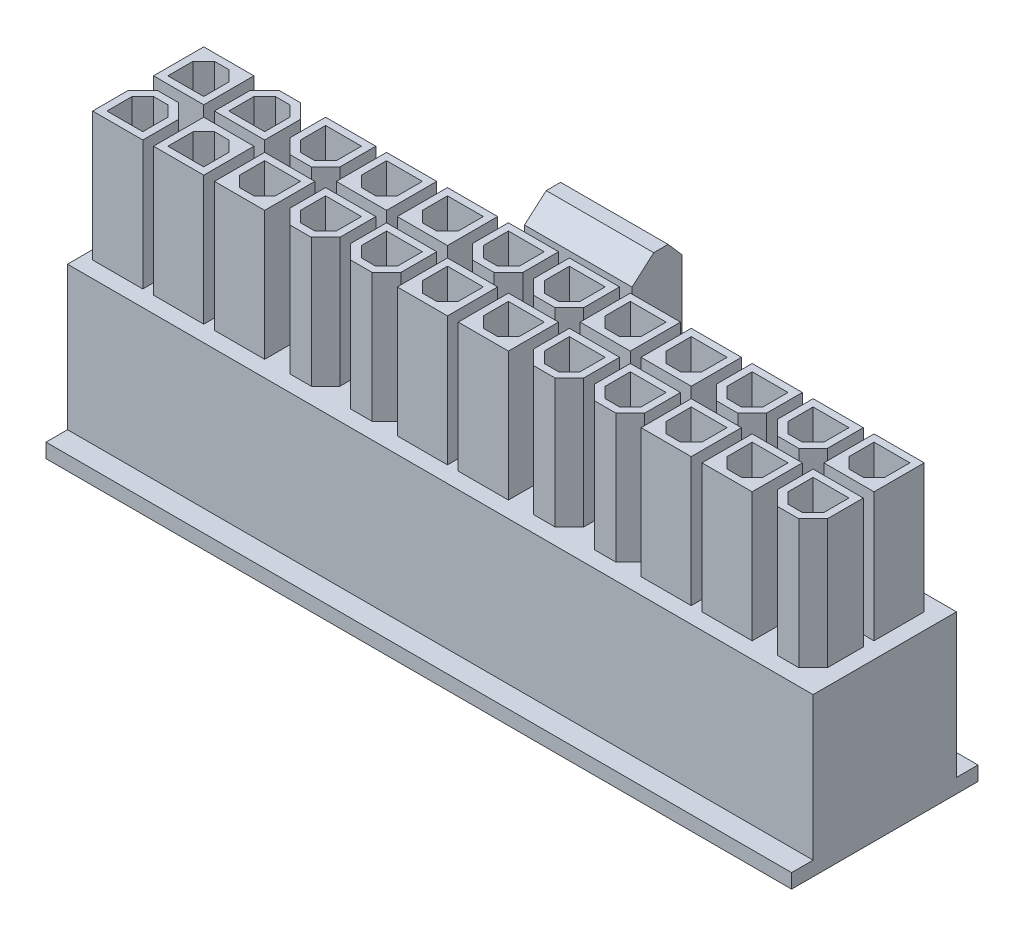
from build123d import *

# Parameters (mm, degrees)
SKIZZE1_W                       = 10
SKIZZE1_H                       = 11
AUFSATZ_LINEAR_AUSTRAGEN1_DEPTH = 26
SKIZZE2_W                       = 1.5
SKIZZE2_H                       = 1
AUFSATZ_LINEAR_AUSTRAGEN2_DEPTH = 26
AUFSATZ_LINEAR_AUSTRAGEN3_DEPTH = 5
SKIZZE4_W                       = 7
SKIZZE4_H                       = 1.5
SCHNITT_LINEAR_AUSTRAGEN1_DEPTH = 30.483045976
AUFSATZ_LINEAR_AUSTRAGEN4_DEPTH = 3.75
SKIZZE6_W                       = 3.75
SKIZZE6_H                       = 3.75
SCHNITT_LINEAR_AUSTRAGEN2_DEPTH = 10
LINEARES_MUSTER1_COUNT          = 12
LINEARES_MUSTER1_PITCH          = 4.25
LINEARES_MUSTER1_COUNT_DIR2     = 2
LINEARES_MUSTER1_PITCH_DIR2     = 4.25
SKIZZE7_W                       = 3.5
SKIZZE7_H                       = 3.5
AUFSATZ_LINEAR_AUSTRAGEN5_DEPTH = 9
LINEARES_START                  = 0.375
LINEARES_MUSTER2_OUTLINE_W      = 3.5
LINEARES_MUSTER2_OUTLINE_H      = 9
LINEARES_MUSTER2_DEPTH          = 3.5
LINEARES_START_2                = -3.875
LINEARES_MUSTER2_2_OUTLINE_W    = 3.5
LINEARES_MUSTER2_2_OUTLINE_H    = 9
LINEARES_MUSTER2_2_DEPTH        = 3.5
AUFSATZ_LINEAR_AUSTRAGEN6_DEPTH = 9
LINEARES_START_3                = 11
LINEARES_MUSTER3_DEPTH          = 9
AUFSATZ_LINEAR_AUSTRAGEN7_DEPTH = 9
LINEARES_START_4                = 10
LINEARES_MUSTER4_DEPTH          = 10
SCHNITT_LINEAR_AUSTRAGEN3_DEPTH = 34.88583775
LINEARES_MUSTER5_COUNT          = 10
LINEARES_MUSTER5_PITCH          = 4.25
LINEARES_MUSTER5_COUNT_DIR2     = 2
LINEARES_MUSTER5_PITCH_DIR2     = 4.25
SCHNITT_LINEAR_AUSTRAGEN4_DEPTH = 34.88583775
LINEARES_MUSTER6_COUNT          = 2
LINEARES_MUSTER6_PITCH          = 4.25
LINEARES_MUSTER6_COUNT_DIR2     = 2
LINEARES_MUSTER6_PITCH_DIR2     = 4.25


with BuildPart() as part:
    # Skizze1 → Aufsatz-Linear austragen1 (new, symmetric)
    with BuildSketch(Plane(origin=(0, 0, 0), x_dir=(0, 0, -1), z_dir=(1, 0, 0))):
        with Locations((0, 5.5)):
            Rectangle(SKIZZE1_W, SKIZZE1_H)
    extrude(amount=AUFSATZ_LINEAR_AUSTRAGEN1_DEPTH, both=True)

    # Skizze2 → Aufsatz-Linear austragen2 (add, symmetric)
    with BuildSketch(Plane(origin=(0, 0, 0), x_dir=(0, 0, -1), z_dir=(1, 0, 0))):
        with Locations((-5.75, 0.5)):
            Rectangle(SKIZZE2_W, SKIZZE2_H)
        with Locations((5.75, 0.5)):
            Rectangle(SKIZZE2_W, SKIZZE2_H)
    extrude(amount=AUFSATZ_LINEAR_AUSTRAGEN2_DEPTH, both=True)

    # Skizze3 → Aufsatz-Linear austragen3 (add, symmetric)
    with BuildSketch(Plane(origin=(0, 0, 0), x_dir=(0, 0, -1), z_dir=(1, 0, 0))):
        with BuildLine():
            Line((5, 11), (5.571713615, 11))
            ThreePointArc((5.571713615, 11), (5.836038655, 10.149642784), (6.535856807, 9.598979842))
            ThreePointArc((6.535856807, 9.598979842), (7.23567496, 9.048316901), (7.5, 8.197959685))
            Line((7.5, 8.197959685), (7.5, 5.197959685))
            Line((7.5, 5.197959685), (8.5, 4))
            Line((8.5, 4), (8.5, 2))
            Line((8.5, 2), (6.5, 2))
            Line((6.5, 2), (6.5, 8))
            Line((6.5, 8), (5, 8))
            Line((5, 8), (5, 11))
        make_face()
    extrude(amount=AUFSATZ_LINEAR_AUSTRAGEN3_DEPTH, both=True)

    # Skizze4 → Schnitt-Linear austragen1 (cut, through all)
    with BuildSketch(Plane.XZ):
        with Locations((0, -5.75)):
            Rectangle(SKIZZE4_W, SKIZZE4_H)
    extrude(amount=-SCHNITT_LINEAR_AUSTRAGEN1_DEPTH, mode=Mode.SUBTRACT)

    # Skizze5 → Aufsatz-Linear austragen4 (add, symmetric)
    with BuildSketch(Plane(origin=(0, 0, 0), x_dir=(0, 0, -1), z_dir=(1, 0, 0))):
        Polygon((8.123516438, 4.451012129), (8.123516438, 19.870653012), (7.136310593, 21), (6.136310593, 21), (4.623516438, 19.677608169), (4.623516438, 17.677608169), (6.123516438, 17.677608169), (6.5, 8), (6.5, 2), align=None)
    extrude(amount=AUFSATZ_LINEAR_AUSTRAGEN4_DEPTH, both=True)

    # Skizze6 → Schnitt-Linear austragen2 (cut)
    with BuildSketch(Plane.XZ):
        with Locations((-23.625, -2.125)):
            Rectangle(SKIZZE6_W, SKIZZE6_H)
    schnitt_linear_austragen2 = extrude(amount=-SCHNITT_LINEAR_AUSTRAGEN2_DEPTH, mode=Mode.SUBTRACT)

    # Lineares Muster1: Schnitt-Linear austragen2 12 × 2
    with Locations(*[(i * LINEARES_MUSTER1_PITCH, 0, j * LINEARES_MUSTER1_PITCH_DIR2) for i in range(LINEARES_MUSTER1_COUNT) for j in range(LINEARES_MUSTER1_COUNT_DIR2) if (i, j) != (0, 0)]):
        add(schnitt_linear_austragen2, mode=Mode.SUBTRACT)

    # Skizze7 → Aufsatz-Linear austragen5 (add)
    with BuildSketch(Plane(origin=(0, 11, 0), x_dir=(1, 0, 0), z_dir=(0, 1, 0))):
        with Locations((23.125, 2.125)):
            Rectangle(SKIZZE7_W, SKIZZE7_H)
    extrude(amount=AUFSATZ_LINEAR_AUSTRAGEN5_DEPTH)

    # Lineares Muster2: read off the stored shape, not the designer's step
    # Lineares Muster2 outline → Lineares Muster2 (add)
    with BuildSketch(Plane.XY.offset(LINEARES_START)):
        with Locations((18.875, 15.5)):
            Rectangle(LINEARES_MUSTER2_OUTLINE_W, LINEARES_MUSTER2_OUTLINE_H)
        with Locations((14.625, 15.5)):
            Rectangle(LINEARES_MUSTER2_OUTLINE_W, LINEARES_MUSTER2_OUTLINE_H)
        with Locations((-19.375, 15.5)):
            Rectangle(LINEARES_MUSTER2_OUTLINE_W, LINEARES_MUSTER2_OUTLINE_H)
        with Locations((-15.125, 15.5)):
            Rectangle(LINEARES_MUSTER2_OUTLINE_W, LINEARES_MUSTER2_OUTLINE_H)
        with Locations((-2.375, 15.5)):
            Rectangle(LINEARES_MUSTER2_OUTLINE_W, LINEARES_MUSTER2_OUTLINE_H)
        with Locations((1.875, 15.5)):
            Rectangle(LINEARES_MUSTER2_OUTLINE_W, LINEARES_MUSTER2_OUTLINE_H)
    extrude(amount=LINEARES_MUSTER2_DEPTH)

    # Lineares Muster2 2 outline → Lineares Muster2 2 (add)
    with BuildSketch(Plane.XY.offset(LINEARES_START_2)):
        with Locations((10.375, 15.5)):
            Rectangle(LINEARES_MUSTER2_2_OUTLINE_W, LINEARES_MUSTER2_2_OUTLINE_H)
        with Locations((-23.625, 15.5)):
            Rectangle(LINEARES_MUSTER2_2_OUTLINE_W, LINEARES_MUSTER2_2_OUTLINE_H)
        with Locations((-10.875, 15.5)):
            Rectangle(LINEARES_MUSTER2_2_OUTLINE_W, LINEARES_MUSTER2_2_OUTLINE_H)
        with Locations((-6.625, 15.5)):
            Rectangle(LINEARES_MUSTER2_2_OUTLINE_W, LINEARES_MUSTER2_2_OUTLINE_H)
        with Locations((6.125, 15.5)):
            Rectangle(LINEARES_MUSTER2_2_OUTLINE_W, LINEARES_MUSTER2_2_OUTLINE_H)
    extrude(amount=LINEARES_MUSTER2_2_DEPTH)

    # Skizze9 → Aufsatz-Linear austragen6 (add)
    with BuildSketch(Plane(origin=(0, 11, 0), x_dir=(1, 0, 0), z_dir=(0, 1, 0))):
        Polygon((24.875, -2.875), (23.875, -3.875), (22.375, -3.875), (21.375, -2.875), (21.375, -0.375), (24.875, -0.375), align=None)
    extrude(amount=AUFSATZ_LINEAR_AUSTRAGEN6_DEPTH)

    # Lineares Muster3: read off the stored shape, not the designer's step
    # Lineares Muster3 outline → Lineares Muster3 (add)
    with BuildSketch(Plane(origin=(0, 0, 0), x_dir=(1, 0, 0), z_dir=(0, 1, 0)).offset(LINEARES_START_3)):
        Polygon((18.125, 0.375), (19.625, 0.375), (20.625, 1.375), (20.625, 3.875), (17.125, 3.875), (17.125, 1.375), align=None)
        Polygon((13.875, 0.375), (15.375, 0.375), (16.375, 1.375), (16.375, 3.875), (12.875, 3.875), (12.875, 1.375), align=None)
        Polygon((1.125, 0.375), (2.625, 0.375), (3.625, 1.375), (3.625, 3.875), (0.125, 3.875), (0.125, 1.375), align=None)
        Polygon((-3.125, 0.375), (-1.625, 0.375), (-0.625, 1.375), (-0.625, 3.875), (-4.125, 3.875), (-4.125, 1.375), align=None)
        Polygon((-15.875, 0.375), (-14.375, 0.375), (-13.375, 1.375), (-13.375, 3.875), (-16.875, 3.875), (-16.875, 1.375), align=None)
        Polygon((8.625, -0.375), (8.625, -2.875), (9.625, -3.875), (11.125, -3.875), (12.125, -2.875), (12.125, -0.375), align=None)
        Polygon((7.875, -2.875), (7.875, -0.375), (4.375, -0.375), (4.375, -2.875), (5.375, -3.875), (6.875, -3.875), align=None)
        Polygon((-4.875, -2.875), (-4.875, -0.375), (-8.375, -0.375), (-8.375, -2.875), (-7.375, -3.875), (-5.875, -3.875), align=None)
        Polygon((-9.125, -2.875), (-9.125, -0.375), (-12.625, -0.375), (-12.625, -2.875), (-11.625, -3.875), (-10.125, -3.875), align=None)
    extrude(amount=LINEARES_MUSTER3_DEPTH)

    # Skizze10 → Aufsatz-Linear austragen7 (add)
    with BuildSketch(Plane(origin=(0, 11, 0), x_dir=(1, 0, 0), z_dir=(0, 1, 0))):
        Polygon((-18.625, 3.875), (-17.625, 2.875), (-17.625, 0.375), (-21.125, 0.375), (-21.125, 2.875), (-20.125, 3.875), align=None)
    extrude(amount=AUFSATZ_LINEAR_AUSTRAGEN7_DEPTH)

    # Lineares Muster4: read off the stored shape, not the designer's step
    # Lineares Muster4 outline → Lineares Muster4 (add)
    with BuildSketch(Plane(origin=(0, 0, 0), x_dir=(1, 0, 0), z_dir=(0, 1, 0)).offset(LINEARES_START_4)):
        Polygon((-21.875, -3.875), (-21.875, -1.375), (-22.875, -0.375), (-24.375, -0.375), (-25.375, -1.375), (-25.375, -3.875), align=None)
    extrude(amount=LINEARES_MUSTER4_DEPTH)

    # Skizze11 → Schnitt-Linear austragen3 (cut, through all)
    with BuildSketch(Plane(origin=(0, 20, 0), x_dir=(1, 0, 0), z_dir=(0, 1, 0))):
        Polygon((23.625, -3.375), (24.375, -2.625), (24.375, -0.875), (21.875, -0.875), (21.875, -2.625), (22.625, -3.375), align=None)
    schnitt_linear_austragen3 = extrude(amount=-SCHNITT_LINEAR_AUSTRAGEN3_DEPTH, mode=Mode.SUBTRACT)

    # Lineares Muster5: Schnitt-Linear austragen3 10 × 2
    with Locations(*[(-i * LINEARES_MUSTER5_PITCH, 0, -j * LINEARES_MUSTER5_PITCH_DIR2) for i in range(LINEARES_MUSTER5_COUNT) for j in range(LINEARES_MUSTER5_COUNT_DIR2) if (i, j) != (0, 0)]):
        add(schnitt_linear_austragen3, mode=Mode.SUBTRACT)

    # Skizze12 → Schnitt-Linear austragen4 (cut, through all)
    with BuildSketch(Plane(origin=(0, 20, 0), x_dir=(1, 0, 0), z_dir=(0, 1, 0))):
        Polygon((-20.625, 2.625), (-19.875, 3.375), (-18.875, 3.375), (-18.125, 2.625), (-18.125, 0.875), (-20.625, 0.875), align=None)
    schnitt_linear_austragen4 = extrude(amount=-SCHNITT_LINEAR_AUSTRAGEN4_DEPTH, mode=Mode.SUBTRACT)

    # Lineares Muster6: Schnitt-Linear austragen4 2 × 2
    with Locations(*[(-i * LINEARES_MUSTER6_PITCH, 0, j * LINEARES_MUSTER6_PITCH_DIR2) for i in range(LINEARES_MUSTER6_COUNT) for j in range(LINEARES_MUSTER6_COUNT_DIR2) if (i, j) != (0, 0)]):
        add(schnitt_linear_austragen4, mode=Mode.SUBTRACT)


solid = part.part
